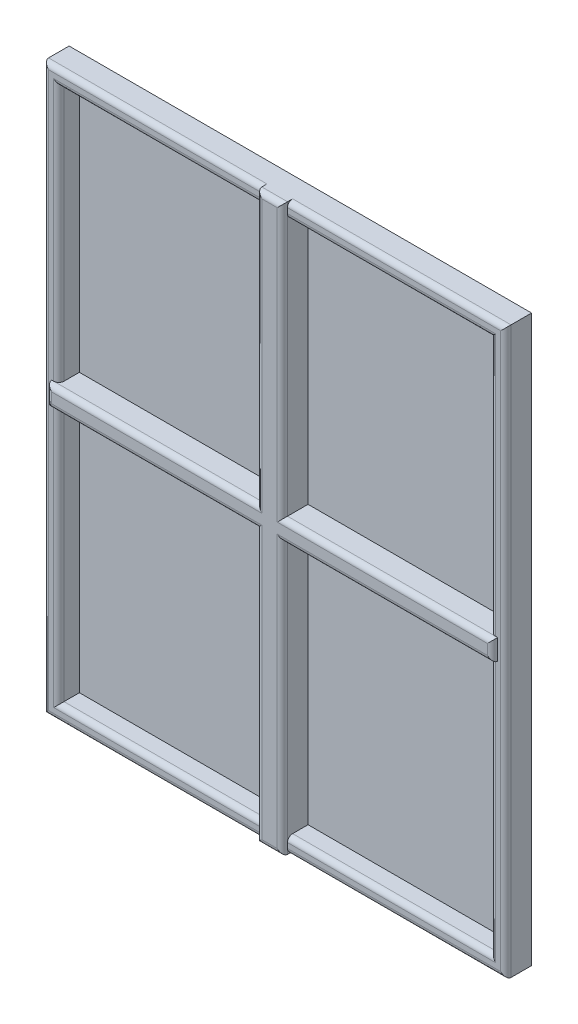
from build123d import *

# Parameters (mm, degrees)
SKETCH1_W           = 900
SKETCH1_H           = 1100
SKETCH1_W_2         = 840
SKETCH1_H_2         = 1040
BOSS_EXTRUDE1_DEPTH = 50
FILLET1_R           = 10
SKETCH2_W           = 50
SKETCH2_H           = 1100
SKETCH2_W_2         = 868
SKETCH2_H_2         = 40
BOSS_EXTRUDE2_DEPTH = 60
FILLET2_R           = 10
SKETCH3_W           = 860
SKETCH3_H           = 1060
BOSS_EXTRUDE3_DEPTH = 10
SCALE2_SCALE        = 0.25
SCALE3_SCALE        = 0.32


with BuildPart() as part:
    # Sketch1 → Boss-Extrude1 (new body)
    with BuildSketch(Plane.XY):
        Rectangle(SKETCH1_W, SKETCH1_H)
        Rectangle(SKETCH1_W_2, SKETCH1_H_2, mode=Mode.SUBTRACT)
    extrude(amount=BOSS_EXTRUDE1_DEPTH)

    # Fillet1
    fillet1_edges = [part.edges().sort_by_distance(p)[0] for p in [
        (-450, 0, 50),
        (0, -550, 50),
        (0, -520, 50),
        (420, 0, 50),
        (0, 520, 50),
        (-420, 0, 50),
        (450, 0, 50),
        (0, 550, 50),
    ]]
    fillet(fillet1_edges, radius=FILLET1_R)

    # Sketch2 → Boss-Extrude2 (add)
    with BuildSketch(Plane.XY):
        Rectangle(SKETCH2_W, SKETCH2_H)
        Rectangle(SKETCH2_W_2, SKETCH2_H_2)
    extrude(amount=BOSS_EXTRUDE2_DEPTH)

    # Fillet2
    fillet2_edges = [part.edges().sort_by_distance(p)[0] for p in [
        (0, -550, 60),
        (-25, -285, 60),
        (-229.5, -20, 60),
        (-434, 0, 60),
        (-229.5, 20, 60),
        (-25, 285, 60),
        (0, 550, 60),
        (25, 285, 60),
        (229.5, 20, 60),
        (434, 0, 60),
        (229.5, -20, 60),
        (25, -285, 60),
    ]]
    fillet(fillet2_edges, radius=FILLET2_R - 0.0001)  # a hair under: the kernel refuses the full size


with BuildPart() as body_2:
    # Sketch3 → Boss-Extrude3 (new body)
    with BuildSketch(Plane.XY):
        Rectangle(SKETCH3_W, SKETCH3_H)
    extrude(amount=BOSS_EXTRUDE3_DEPTH)


with BuildPart() as part_1:
    # Scale2: scaled about (0, 0, 0)
    add(part.part.scale(SCALE2_SCALE))


with BuildPart() as body_2_1:
    # Scale2: scaled about (0, 0, 0)
    add(body_2.part.scale(SCALE2_SCALE))


with BuildPart() as part_2:
    # Scale3: scaled about (0, 0, 0)
    add(part_1.part.scale(SCALE3_SCALE))


with BuildPart() as body_2_2:
    # Scale3: scaled about (0, 0, 0)
    add(body_2_1.part.scale(SCALE3_SCALE))


solid = Compound([part_2.part, body_2_2.part])
